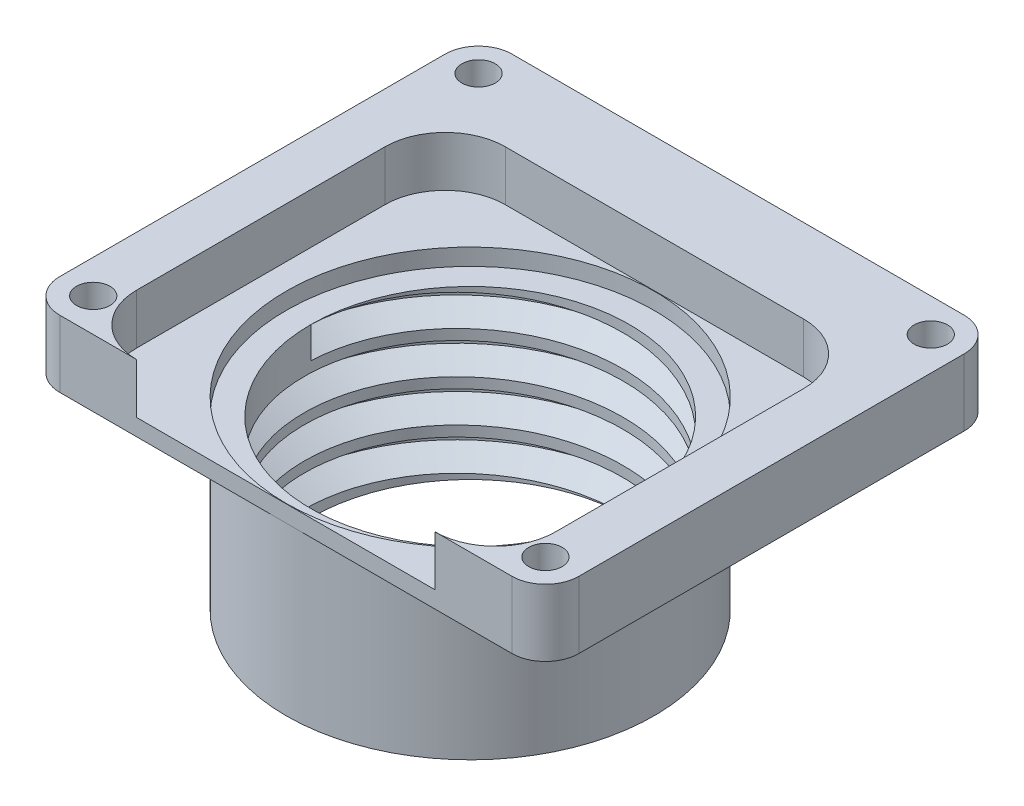
from build123d import *

# Parameters (mm, degrees)
SKETCH1_R           = 1.27
MAIN_BODY_DEPTH     = 5.08
COVER_DEPTH         = 1.27
C_MOUNT_JOINT_DEPTH = 12.7
THREAD1_PITCH       = 3.175


with BuildPart() as part:
    # Sketch1 → Main Body (new body)
    with BuildSketch(Plane(origin=(0, 0, 0), x_dir=(1, 0, 0), z_dir=(0, 1, 0))):
        with BuildLine():
            ThreePointArc((-19.712076836, -14.632076836), (-18.968128061, -16.428128061), (-17.172076836, -17.172076836))
            Line((-17.172076836, -17.172076836), (-11.330076836, -17.172076836))
            ThreePointArc((-11.330076836, -17.172076836), (-14.56296904, -15.83296904), (-15.902076836, -12.600076836))
            Line((-15.902076836, -12.600076836), (-15.902076836, -3.175))
            Line((-15.902076836, -3.175), (-15.902076836, 6.250076836))
            ThreePointArc((-15.902076836, 6.250076836), (-14.56296904, 9.48296904), (-11.330076836, 10.822076836))
            Line((-11.330076836, 10.822076836), (11.330076836, 10.822076836))
            ThreePointArc((11.330076836, 10.822076836), (14.56296904, 9.48296904), (15.902076836, 6.250076836))
            Line((15.902076836, 6.250076836), (15.902076836, -3.175))
            Line((15.902076836, -3.175), (15.902076836, -12.600076836))
            ThreePointArc((15.902076836, -12.600076836), (14.56296904, -15.83296904), (11.330076836, -17.172076836))
            Line((11.330076836, -17.172076836), (17.172076836, -17.172076836))
            ThreePointArc((17.172076836, -17.172076836), (18.968128061, -16.428128061), (19.712076836, -14.632076836))
            Line((19.712076836, -14.632076836), (19.712076836, 14.632076836))
            ThreePointArc((19.712076836, 14.632076836), (18.968128061, 16.428128061), (17.172076836, 17.172076836))
            Line((17.172076836, 17.172076836), (-17.172076836, 17.172076836))
            ThreePointArc((-17.172076836, 17.172076836), (-18.968128061, 16.428128061), (-19.712076836, 14.632076836))
            Line((-19.712076836, 14.632076836), (-19.712076836, -14.632076836))
        make_face()
        with Locations(Location((-17.172076836, -14.632076836, 0), (0, 0, 270))):
            Circle(SKETCH1_R, mode=Mode.SUBTRACT)
        with Locations(Location((17.172076836, -14.632076836, 0), (0, 0, 270))):
            Circle(SKETCH1_R, mode=Mode.SUBTRACT)
        with Locations(Location((-17.172076836, 14.632076836, 0), (0, 0, 270))):
            Circle(SKETCH1_R, mode=Mode.SUBTRACT)
        with Locations(Location((17.172076836, 14.632076836, 0), (0, 0, 270))):
            Circle(SKETCH1_R, mode=Mode.SUBTRACT)
    extrude(amount=MAIN_BODY_DEPTH)

    # Sketch1<5> → Cover (add)
    with BuildSketch(Plane(origin=(0, 0, 0), x_dir=(1, 0, 0), z_dir=(0, 1, 0))):
        with BuildLine():
            Line((-15.902076836, 6.250076836), (-15.902076836, -3.175))
            Line((-15.902076836, -3.175), (-13.97, -3.175))
            ThreePointArc((-13.97, -3.175), (0, 10.795), (13.97, -3.175))
            Line((13.97, -3.175), (15.902076836, -3.175))
            Line((15.902076836, -3.175), (15.902076836, 6.250076836))
            ThreePointArc((15.902076836, 6.250076836), (14.56296904, 9.48296904), (11.330076836, 10.822076836))
            Line((11.330076836, 10.822076836), (-11.330076836, 10.822076836))
            ThreePointArc((-11.330076836, 10.822076836), (-14.56296904, 9.48296904), (-15.902076836, 6.250076836))
        make_face()
        with BuildLine():
            ThreePointArc((-15.902076836, -12.600076836), (-14.56296904, -15.83296904), (-11.330076836, -17.172076836))
            Line((-11.330076836, -17.172076836), (11.330076836, -17.172076836))
            ThreePointArc((11.330076836, -17.172076836), (14.56296904, -15.83296904), (15.902076836, -12.600076836))
            Line((15.902076836, -12.600076836), (15.902076836, -3.175))
            Line((15.902076836, -3.175), (13.97, -3.175))
            ThreePointArc((13.97, -3.175), (0, -17.145), (-13.97, -3.175))
            Line((-13.97, -3.175), (-15.902076836, -3.175))
            Line((-15.902076836, -3.175), (-15.902076836, -12.600076836))
        make_face()
    extrude(amount=COVER_DEPTH)


with BuildPart() as body_2:
    # Sketch1<6> → C-mount-joint (new body)
    with BuildSketch(Plane(origin=(0, 0, 0), x_dir=(1, 0, 0), z_dir=(0, 1, 0))):
        with BuildLine():
            ThreePointArc((13.97, -3.175), (0, 10.795), (-13.97, -3.175))
            Line((-13.97, -3.175), (-12.10437, -3.175))
            ThreePointArc((-12.10437, -3.175), (0, 8.92937), (12.10437, -3.175))
            Line((12.10437, -3.175), (13.97, -3.175))
        make_face()
        with BuildLine():
            Line((-12.10437, -3.175), (-13.97, -3.175))
            ThreePointArc((-13.97, -3.175), (0, -17.145), (13.97, -3.175))
            Line((13.97, -3.175), (12.10437, -3.175))
            ThreePointArc((12.10437, -3.175), (0, -15.27937), (-12.10437, -3.175))
        make_face()
    extrude(amount=-C_MOUNT_JOINT_DEPTH)

    # Thread1: the profile of Thread Profile1 profile screwed along a right-hand helix of 4 turns, 12 arcs to a turn; built about Z, then put on its axis
    thread1_z = Axis((0, 0, 0), (0, 0, 1))
    thread1_corners = [(12.10407, 0, -0.000173205), (13.822889153, 0, 0.992187496), (13.822889153, 0, 1.389062496), (12.10407, 0, 2.381423196)]
    with BuildLine(mode=Mode.PRIVATE) as thread1_profile:
        Line(thread1_corners[0], thread1_corners[1])
        Line(thread1_corners[1], thread1_corners[2])
        Line(thread1_corners[2], thread1_corners[3])
        Line(thread1_corners[3], thread1_corners[0])
    thread1_cap = Face(thread1_profile.wire())
    thread1_turn_angles = [0, 15, 30, 45, 60, 75, 90, 105, 120, 135, 150, 165, 180, 195, 210, 225, 240, 255, 270, 285, 300, 315, 330, 345, 360]
    thread1_turn_weights = [1, 0.9659258262890683, 1, 0.9659258262890683, 1, 0.9659258262890683, 1, 0.9659258262890683, 1, 0.9659258262890683, 1, 0.9659258262890683, 1, 0.9659258262890683, 1, 0.9659258262890683, 1, 0.9659258262890683, 1, 0.9659258262890683, 1, 0.9659258262890683, 1, 0.9659258262890683, 1]
    thread1_turn_rails = [Edge.make_bspline([Vector(p[0], p[1], 0).rotate(thread1_z, thread1_turn_angles[k]) / thread1_turn_weights[k] + Vector(0, 0, p[2] + THREAD1_PITCH * thread1_turn_angles[k] / 360) for k in range(25)], [0, 0, 0, 1, 1, 2, 2, 3, 3, 4, 4, 5, 5, 6, 6, 7, 7, 8, 8, 9, 9, 10, 10, 11, 11, 12, 12, 12], 2, thread1_turn_weights) for p in thread1_corners]
    thread1_turn_sides = [Face.make_surface_from_curves(thread1_turn_rails[p[0]], thread1_turn_rails[p[1]]) for p in [(0, 1), (1, 2), (2, 3), (3, 0)]]
    thread1 = Plane(origin=(0, 0, 3.175), x_dir=(-1, 0, 0), z_dir=(0, -1, 0)) * Solid(Shell([*[p.moved(Location((0, 0, THREAD1_PITCH * i))) for i in range(4) for p in thread1_turn_sides], thread1_cap, thread1_cap.rotate(thread1_z, 1440).moved(Location((0, 0, THREAD1_PITCH * 1440 / 360)))]))
    add(thread1, mode=Mode.SUBTRACT)


solid = Compound([part.part, body_2.part])
